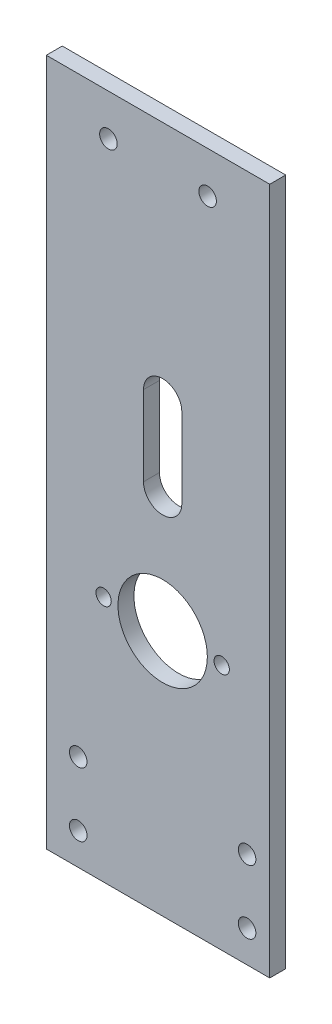
from build123d import *

# Parameters (mm, degrees)
SKETCH1_W           = 70
SKETCH1_H           = 154.713144252
SKETCH1_R           = 2.75
SKETCH1_R_2         = 2.4
SKETCH1_R_3         = 14
BOSS_EXTRUDE1_DEPTH = 5
SKETCH1_4_W         = 70
SKETCH1_4_H         = 118
SKETCH1_4_R         = 2.75
BOSS_EXTRUDE2_DEPTH = 5
CUT_EXTRUDE1_START  = -10
SKETCH2_W           = 70
SKETCH2_H           = 57.356572126
CUT_EXTRUDE1_DEPTH  = 10


with BuildPart() as part:
    # Sketch1 → Boss-Extrude1 (new body)
    with BuildSketch(Plane.XY):
        with Locations((-1.450472168, 0)):
            Rectangle(SKETCH1_W, SKETCH1_H)
        with Locations((-26.450472168, -10)):
            Circle(SKETCH1_R, mode=Mode.SUBTRACT)
        with BuildLine():
            ThreePointArc((-17.05, -64.643427874), (-15.5, -63.093427874), (-13.95, -64.643427874))
            Line((-13.95, -64.643427874), (-13.95, -71.643427874))
            ThreePointArc((-13.95, -71.643427874), (-15.5, -73.193427874), (-17.05, -71.643427874))
            Line((-17.05, -71.643427874), (-17.05, -64.643427874))
        make_face(mode=Mode.SUBTRACT)
        with BuildLine():
            ThreePointArc((-17.05, -33.643427874), (-15.5, -32.093427874), (-13.95, -33.643427874))
            Line((-13.95, -33.643427874), (-13.95, -40.643427874))
            ThreePointArc((-13.95, -40.643427874), (-15.5, -42.193427874), (-17.05, -40.643427874))
            Line((-17.05, -40.643427874), (-17.05, -33.643427874))
        make_face(mode=Mode.SUBTRACT)
        with Locations((-26.450472168, 10)):
            Circle(SKETCH1_R, mode=Mode.SUBTRACT)
        with Locations((-18.5, 57.356572126)):
            Circle(SKETCH1_R_2, mode=Mode.SUBTRACT)
        with BuildLine():
            ThreePointArc((12, -56.143427874), (0, -68.143427874), (-12, -56.143427874))
            Line((-12, -56.143427874), (-12, -49.143427874))
            ThreePointArc((-12, -49.143427874), (0, -37.143427874), (12, -49.143427874))
            Line((12, -49.143427874), (12, -56.143427874))
        make_face(mode=Mode.SUBTRACT)
        with BuildLine():
            ThreePointArc((13.95, -64.643427874), (15.5, -63.093427874), (17.05, -64.643427874))
            Line((17.05, -64.643427874), (17.05, -71.643427874))
            ThreePointArc((17.05, -71.643427874), (15.5, -73.193427874), (13.95, -71.643427874))
            Line((13.95, -71.643427874), (13.95, -64.643427874))
        make_face(mode=Mode.SUBTRACT)
        with BuildLine():
            ThreePointArc((13.95, -33.643427874), (15.5, -32.093427874), (17.05, -33.643427874))
            Line((17.05, -33.643427874), (17.05, -40.643427874))
            ThreePointArc((17.05, -40.643427874), (15.5, -42.193427874), (13.95, -40.643427874))
            Line((13.95, -40.643427874), (13.95, -33.643427874))
        make_face(mode=Mode.SUBTRACT)
        with Locations((26.450472168, -10)):
            Circle(SKETCH1_R, mode=Mode.SUBTRACT)
        with Locations((0, 57.356572126)):
            Circle(SKETCH1_R_3, mode=Mode.SUBTRACT)
        with Locations((26.450472168, 10)):
            Circle(SKETCH1_R, mode=Mode.SUBTRACT)
        with Locations((18.5, 57.356572126)):
            Circle(SKETCH1_R_2, mode=Mode.SUBTRACT)
    extrude(amount=BOSS_EXTRUDE1_DEPTH)

    # Sketch1<4> → Boss-Extrude2 (add)
    with BuildSketch(Plane.XY):
        with Locations((-1.450472168, 136.356572126)):
            Rectangle(SKETCH1_4_W, SKETCH1_4_H)
        with Locations((-16.991825546, 182.387739686)):
            Circle(SKETCH1_4_R, mode=Mode.SUBTRACT)
        with BuildLine():
            ThreePointArc((-6, 119.856572126), (0, 125.856572126), (6, 119.856572126))
            Line((6, 119.856572126), (6, 94.856572126))
            ThreePointArc((6, 94.856572126), (0, 88.856572126), (-6, 94.856572126))
            Line((-6, 94.856572126), (-6, 119.856572126))
        make_face(mode=Mode.SUBTRACT)
        with Locations((14.09088121, 182.387739686)):
            Circle(SKETCH1_4_R, mode=Mode.SUBTRACT)
    extrude(amount=BOSS_EXTRUDE2_DEPTH)

    # Sketch2 → Cut-Extrude1 (cut)
    with BuildSketch(Plane.XY.offset(5).offset(CUT_EXTRUDE1_START)):
        with Locations((-1.450472168, -48.678286063)):
            Rectangle(SKETCH2_W, SKETCH2_H)
        with BuildLine():
            Line((-13.95, -64.643427874), (-13.95, -71.643427874))
            ThreePointArc((-13.95, -71.643427874), (-15.5, -73.193427874), (-17.05, -71.643427874))
            Line((-17.05, -71.643427874), (-17.05, -64.643427874))
            ThreePointArc((-17.05, -64.643427874), (-15.5, -63.093427874), (-13.95, -64.643427874))
        make_face(mode=Mode.SUBTRACT)
        with BuildLine():
            Line((-13.95, -33.643427874), (-13.95, -40.643427874))
            ThreePointArc((-13.95, -40.643427874), (-15.5, -42.193427874), (-17.05, -40.643427874))
            Line((-17.05, -40.643427874), (-17.05, -33.643427874))
            ThreePointArc((-17.05, -33.643427874), (-15.5, -32.093427874), (-13.95, -33.643427874))
        make_face(mode=Mode.SUBTRACT)
        with BuildLine():
            Line((-12, -56.143427874), (-12, -49.143427874))
            ThreePointArc((-12, -49.143427874), (0, -37.143427874), (12, -49.143427874))
            Line((12, -49.143427874), (12, -56.143427874))
            ThreePointArc((12, -56.143427874), (0, -68.143427874), (-12, -56.143427874))
        make_face(mode=Mode.SUBTRACT)
        with BuildLine():
            Line((17.05, -64.643427874), (17.05, -71.643427874))
            ThreePointArc((17.05, -71.643427874), (15.5, -73.193427874), (13.95, -71.643427874))
            Line((13.95, -71.643427874), (13.95, -64.643427874))
            ThreePointArc((13.95, -64.643427874), (15.5, -63.093427874), (17.05, -64.643427874))
        make_face(mode=Mode.SUBTRACT)
        with BuildLine():
            Line((17.05, -33.643427874), (17.05, -40.643427874))
            ThreePointArc((17.05, -40.643427874), (15.5, -42.193427874), (13.95, -40.643427874))
            Line((13.95, -40.643427874), (13.95, -33.643427874))
            ThreePointArc((13.95, -33.643427874), (15.5, -32.093427874), (17.05, -33.643427874))
        make_face(mode=Mode.SUBTRACT)
    extrude(amount=CUT_EXTRUDE1_DEPTH, mode=Mode.SUBTRACT)


solid = part.part
